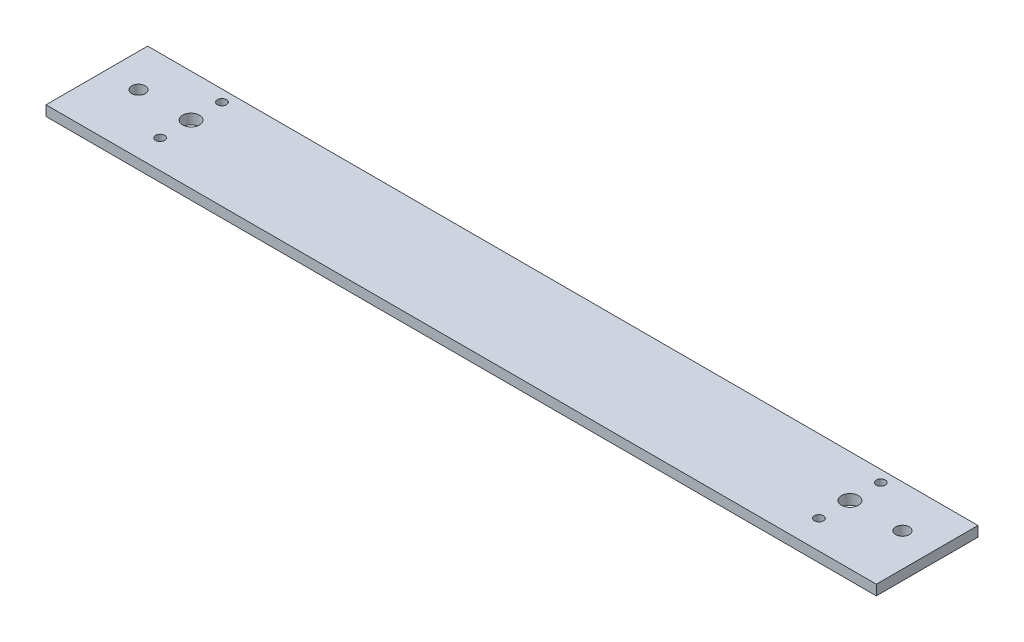
from build123d import *

# Parameters (mm, degrees)
SKETCH2_W                  = 490
SKETCH2_H                  = 60
BOSS_EXTRUDE1_DEPTH        = 6
F_10_0_10_DIAMETER_HOLE1_D = 10
M5_CLEARANCE_HOLE1_D       = 5.3
F_8_0_8_DIAMETER_HOLE1_D   = 8


with BuildPart() as part:
    # Sketch2 → Boss-Extrude1 (new body)
    with BuildSketch(Plane(origin=(0, 0, 0), x_dir=(1, 0, 0), z_dir=(0, 1, 0))):
        Rectangle(SKETCH2_W, SKETCH2_H)
    extrude(amount=BOSS_EXTRUDE1_DEPTH)

    # Ø10.0 (10) Diameter Hole1 (through all)
    with Locations(Plane(origin=(0, 6, 0), x_dir=(1, 0, 0), z_dir=(0, 1, 0))):
        with Locations((194.4, 5)):
            f_10_0_10_diameter_hole1 = Hole(F_10_0_10_DIAMETER_HOLE1_D / 2)

    # M5 Clearance Hole1 (through all)
    with Locations(Plane(origin=(0, 6, 0), x_dir=(1, 0, 0), z_dir=(0, 1, 0))):
        with Locations((194.4, -13.25), (194.4, 23.25)):
            m5_clearance_hole1 = Hole(M5_CLEARANCE_HOLE1_D / 2)

    # Ø8.0 (8) Diameter Hole1 (through all)
    with Locations(Plane(origin=(0, 6, 0), x_dir=(1, 0, 0), z_dir=(0, 1, 0))):
        with Locations((225.4, 5)):
            f_8_0_8_diameter_hole1 = Hole(F_8_0_8_DIAMETER_HOLE1_D / 2)

    # Mirror1: Ø10.0 (10) Diameter Hole1, M5 Clearance Hole1, Ø8.0 (8) Diameter Hole1 across plane
    add(f_10_0_10_diameter_hole1.mirror(Plane(origin=(0, 0, 0), x_dir=(0, 0, 1), z_dir=(1, 0, 0))), mode=Mode.SUBTRACT)
    add(m5_clearance_hole1.mirror(Plane(origin=(0, 0, 0), x_dir=(0, 0, 1), z_dir=(1, 0, 0))), mode=Mode.SUBTRACT)
    add(f_8_0_8_diameter_hole1.mirror(Plane(origin=(0, 0, 0), x_dir=(0, 0, 1), z_dir=(1, 0, 0))), mode=Mode.SUBTRACT)


solid = part.part
